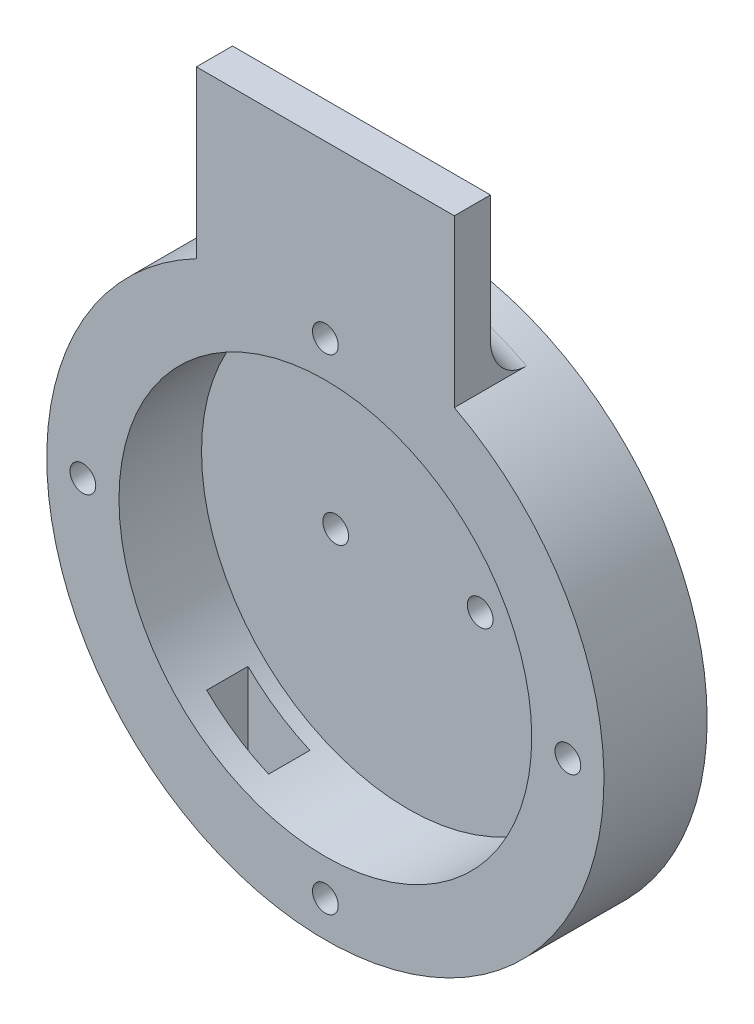
from build123d import *

# Parameters (mm, degrees)
SKETCH1_R               = 27
SKETCH1_R_2             = 1.25
SKETCH1_R_3             = 20
BOSS_EXTRUDE1_DEPTH     = 10
SKETCH3_R               = 20
SKETCH3_R_2             = 1.25
BOSS_EXTRUDE2_DEPTH     = 2
BOSS_EXTRUDE3_DEPTH     = 3.5
CUT_EXTRUDE1_REACH      = 51.311
CUT_EXTRUDE1_END_RADIUS = 27
SKETCH4_W               = 6
SKETCH4_H               = 4
FILLET1_R               = 3.5


with BuildPart() as part:
    # Sketch1 → Boss-Extrude1 (new body)
    with BuildSketch(Plane.XY):
        Circle(SKETCH1_R)
        with Locations((0, 23.5)):
            Circle(SKETCH1_R_2, mode=Mode.SUBTRACT)
        with Locations((23.5, 0)):
            Circle(SKETCH1_R_2, mode=Mode.SUBTRACT)
        with Locations((0, -23.5)):
            Circle(SKETCH1_R_2, mode=Mode.SUBTRACT)
        with Locations((-23.5, 0)):
            Circle(SKETCH1_R_2, mode=Mode.SUBTRACT)
        Circle(SKETCH1_R_3, mode=Mode.SUBTRACT)
    extrude(amount=BOSS_EXTRUDE1_DEPTH)

    # Sketch3 → Boss-Extrude2 (add)
    with BuildSketch(Plane.XY):
        Circle(SKETCH3_R)
        with Locations((-7, 0)):
            Circle(SKETCH3_R_2, mode=Mode.SUBTRACT)
        with Locations((7, 0)):
            Circle(SKETCH3_R_2, mode=Mode.SUBTRACT)
    extrude(amount=BOSS_EXTRUDE2_DEPTH)

    # Sketch5 → Boss-Extrude3 (add)
    with BuildSketch(Plane.XY.offset(10)):
        Polygon((-12.5, 23.932195888), (-4.251935746, 23.932195888), (0, 26.25446737), (4.267780323, 23.932195888), (12.5, 23.932195888), (12.5, 40.032195888), (-12.5, 40.032195888), align=None)
    extrude(amount=-BOSS_EXTRUDE3_DEPTH)

    # Cut-Extrude1: up to this cylinder (the profile starts inside it)
    cut_extrude1_end = Plane(origin=(0, 0, 5.5), z_dir=(0, 0, -1)) * Cylinder(CUT_EXTRUDE1_END_RADIUS, 157.622, mode=Mode.PRIVATE)
    # Sketch4 → Cut-Extrude1 (cut, up to the surface)
    with BuildSketch(Plane(origin=(0, 0, 0), x_dir=(1, 0, 0), z_dir=(0, 1, 0)), mode=Mode.PRIVATE) as cut_extrude1_sk1:
        with Locations((-11, -5.5)):
            Rectangle(SKETCH4_W, SKETCH4_H)
    cut_extrude1_tool1 = extrude(cut_extrude1_sk1.sketch, amount=-CUT_EXTRUDE1_REACH, mode=Mode.PRIVATE) & cut_extrude1_end
    add(cut_extrude1_tool1.solids().sort_by_distance((-11, 0, 5.5))[0], mode=Mode.SUBTRACT)

    # Fillet1
    fillet1_edges = [part.edges().sort_by_distance(p)[0] for p in [
        (0, 27, 6.5),
    ]]
    fillet(fillet1_edges, radius=FILLET1_R)


solid = part.part
